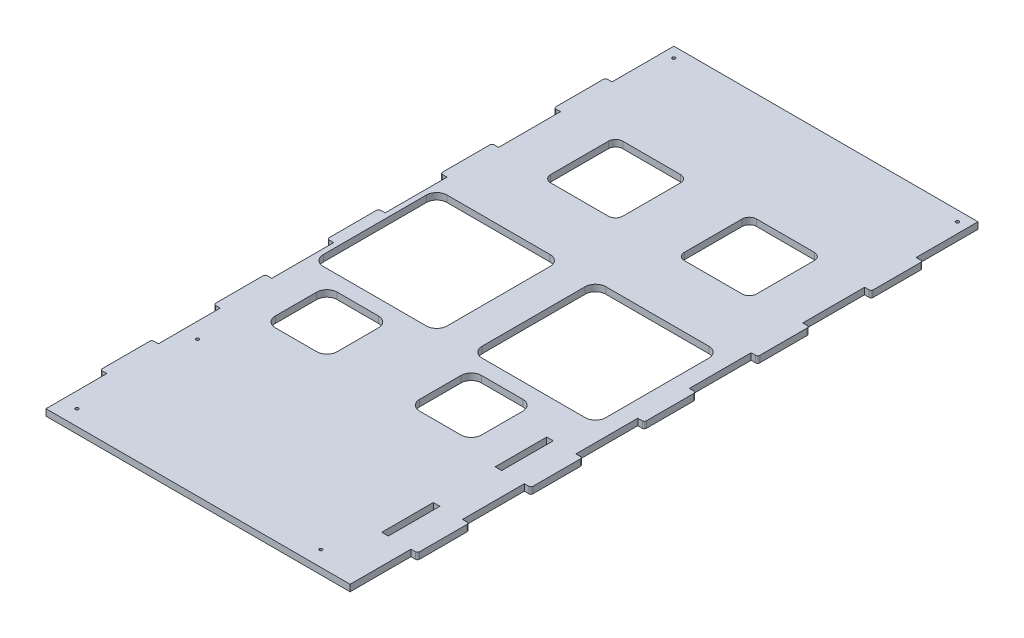
from build123d import *

# Parameters (mm, degrees)
BOSS_EXTRUDE1_DEPTH = 6.35
FILLET1_R           = 2
SKETCH2_R           = 1.5
SKETCH2_W           = 6.35
SKETCH2_H           = 50
SKETCH2_W_2         = 120
SKETCH2_H_2         = 120
CUT_EXTRUDE1_DEPTH  = 6.35
FILLET2_R           = 10


with BuildPart() as part:
    # Sketch1 → Boss-Extrude1 (new body)
    with BuildSketch(Plane(origin=(0, 0, 0), x_dir=(1, 0, 0), z_dir=(0, 1, 0))):
        Polygon((0, 0), (295, 0), (295, 59), (301.35, 59), (301.35, 109), (295, 109), (295, 169), (301.35, 169), (301.35, 219), (295, 219), (295, 279), (301.35, 279), (301.35, 329), (295, 329), (295, 389), (301.35, 389), (301.35, 439), (295, 439), (295, 499), (301.35, 499), (301.35, 549), (295, 549), (295, 609), (0, 609), (0, 549), (-6.35, 549), (-6.35, 499), (0, 499), (0, 439), (-6.35, 439), (-6.35, 389), (0, 389), (0, 329), (-6.35, 329), (-6.35, 279), (0, 279), (0, 219), (-6.35, 219), (-6.35, 169), (0, 169), (0, 109), (-6.35, 109), (-6.35, 59), (0, 59), align=None)
    extrude(amount=BOSS_EXTRUDE1_DEPTH)

    # Fillet1
    fillet1_edges = [part.edges().sort_by_distance(p)[0] for p in [
        (301.35, 3.175, -549),
        (301.35, 3.175, -499),
        (301.35, 3.175, -439),
        (301.35, 3.175, -389),
        (301.35, 3.175, -329),
        (301.35, 3.175, -279),
        (301.35, 3.175, -219),
        (301.35, 3.175, -169),
        (301.35, 3.175, -109),
        (301.35, 3.175, -59),
        (-6.35, 3.175, -59),
        (-6.35, 3.175, -109),
        (-6.35, 3.175, -169),
        (-6.35, 3.175, -219),
        (-6.35, 3.175, -279),
        (-6.35, 3.175, -329),
        (-6.35, 3.175, -389),
        (-6.35, 3.175, -439),
        (-6.35, 3.175, -499),
        (-6.35, 3.175, -549),
    ]]
    fillet(fillet1_edges, radius=FILLET1_R)

    # Sketch2 → Cut-Extrude1 (cut)
    with BuildSketch(Plane(origin=(0, 6.35, 0), x_dir=(1, 0, 0), z_dir=(0, 1, 0))):
        with Locations((15, 15)):
            Circle(SKETCH2_R)
        with Locations((251.65, 15)):
            Circle(SKETCH2_R)
        with Locations((15, 131.925897501)):
            Circle(SKETCH2_R)
        with Locations((10, 599)):
            Circle(SKETCH2_R)
        with Locations((285, 599)):
            Circle(SKETCH2_R)
        with Locations((269.825, 194)):
            Rectangle(SKETCH2_W, SKETCH2_H)
        with Locations((269.825, 84)):
            Rectangle(SKETCH2_W, SKETCH2_H)
        with BuildLine():
            Line((55.042435698, 504.435466218), (111.042435698, 504.435466218))
            ThreePointArc((111.042435698, 504.435466218), (115.992183166, 502.385213686), (118.042435698, 497.435466218))
            Line((118.042435698, 497.435466218), (118.042435698, 441.435466218))
            ThreePointArc((118.042435698, 441.435466218), (115.992183166, 436.48571875), (111.042435698, 434.435466218))
            Line((111.042435698, 434.435466218), (55.042435698, 434.435466218))
            ThreePointArc((55.042435698, 434.435466218), (50.09268823, 436.48571875), (48.042435698, 441.435466218))
            Line((48.042435698, 441.435466218), (48.042435698, 497.435466218))
            ThreePointArc((48.042435698, 497.435466218), (50.09268823, 502.385213686), (55.042435698, 504.435466218))
        make_face()
        with BuildLine():
            Line((185.233522799, 503.969461472), (241.233522799, 503.969461472))
            ThreePointArc((241.233522799, 503.969461472), (246.183270267, 501.91920894), (248.233522799, 496.969461472))
            Line((248.233522799, 496.969461472), (248.233522799, 440.969461472))
            ThreePointArc((248.233522799, 440.969461472), (246.183270267, 436.019714004), (241.233522799, 433.969461472))
            Line((241.233522799, 433.969461472), (185.233522799, 433.969461472))
            ThreePointArc((185.233522799, 433.969461472), (180.283775331, 436.019714004), (178.233522799, 440.969461472))
            Line((178.233522799, 440.969461472), (178.233522799, 496.969461472))
            ThreePointArc((178.233522799, 496.969461472), (180.283775331, 501.91920894), (185.233522799, 503.969461472))
        make_face()
        with BuildLine():
            Line((43.325, 239.143159068), (83.325, 239.143159068))
            ThreePointArc((83.325, 239.143159068), (90.396067812, 236.21422688), (93.325, 229.143159068))
            Line((93.325, 229.143159068), (93.325, 189.143159068))
            ThreePointArc((93.325, 189.143159068), (90.396067812, 182.072091256), (83.325, 179.143159068))
            Line((83.325, 179.143159068), (43.325, 179.143159068))
            ThreePointArc((43.325, 179.143159068), (36.253932188, 182.072091256), (33.325, 189.143159068))
            Line((33.325, 189.143159068), (33.325, 229.143159068))
            ThreePointArc((33.325, 229.143159068), (36.253932188, 236.21422688), (43.325, 239.143159068))
        make_face()
        with Locations((65, 313.959589149)):
            Rectangle(SKETCH2_W_2, SKETCH2_H_2)
        with Locations((219, 313.959589149)):
            Rectangle(SKETCH2_W_2, SKETCH2_H_2)
        with BuildLine():
            Line((173.325, 229.143159068), (173.325, 189.143159068))
            ThreePointArc((173.325, 189.143159068), (176.253932188, 182.072091256), (183.325, 179.143159068))
            Line((183.325, 179.143159068), (223.325, 179.143159068))
            ThreePointArc((223.325, 179.143159068), (230.396067812, 182.072091256), (233.325, 189.143159068))
            Line((233.325, 189.143159068), (233.325, 229.143159068))
            ThreePointArc((233.325, 229.143159068), (230.396067812, 236.21422688), (223.325, 239.143159068))
            Line((223.325, 239.143159068), (183.325, 239.143159068))
            ThreePointArc((183.325, 239.143159068), (176.253932188, 236.21422688), (173.325, 229.143159068))
        make_face()
    extrude(amount=-CUT_EXTRUDE1_DEPTH, mode=Mode.SUBTRACT)

    # Fillet2
    fillet2_edges = [part.edges().sort_by_distance(p)[0] for p in [
        (125, 3.175, -253.959589149),
        (5, 3.175, -253.959589149),
        (5, 3.175, -373.959589149),
        (125, 3.175, -373.959589149),
        (159, 3.175, -253.959589149),
        (279, 3.175, -253.959589149),
        (279, 3.175, -373.959589149),
        (159, 3.175, -373.959589149),
    ]]
    fillet(fillet2_edges, radius=FILLET2_R)


solid = part.part
